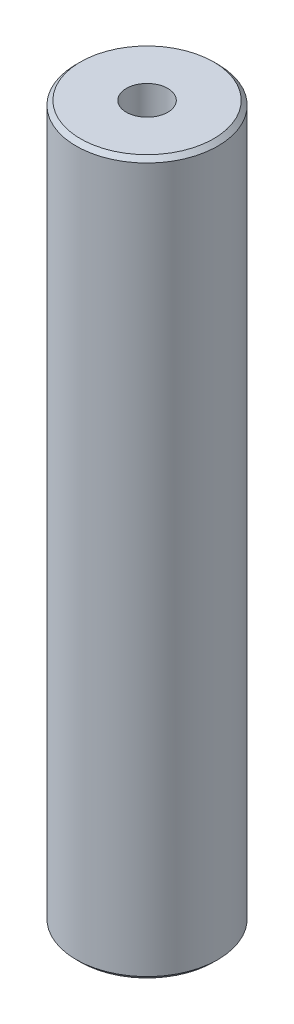
from build123d import *

# Parameters (mm, degrees)
SKETCH1_R           = 17.5
BOSS_EXTRUDE1_DEPTH = 176.149081973
SKETCH2_R           = 5.117647091
CUT_EXTRUDE1_DEPTH  = 178.879169887
CHAMFER1_SIZE       = 1.046641137


with BuildPart() as part:
    # Sketch1 → Boss-Extrude1 (new body)
    with BuildSketch(Plane(origin=(0, 0, 0), x_dir=(1, 0, 0), z_dir=(0, 1, 0))):
        Circle(SKETCH1_R)
    extrude(amount=BOSS_EXTRUDE1_DEPTH)

    # Sketch2 → Cut-Extrude1 (cut, through all)
    with BuildSketch(Plane(origin=(0, 0, 0), x_dir=(1, 0, 0), z_dir=(0, 1, 0))):
        Circle(SKETCH2_R)
    extrude(amount=CUT_EXTRUDE1_DEPTH, mode=Mode.SUBTRACT)

    # Chamfer1
    chamfer1_edges = [part.edges().sort_by_distance(p)[0] for p in [
        (-17.5, 176.149081973, 0),
        (-17.5, 0, 0),
    ]]
    chamfer(chamfer1_edges, length=CHAMFER1_SIZE)


solid = part.part
